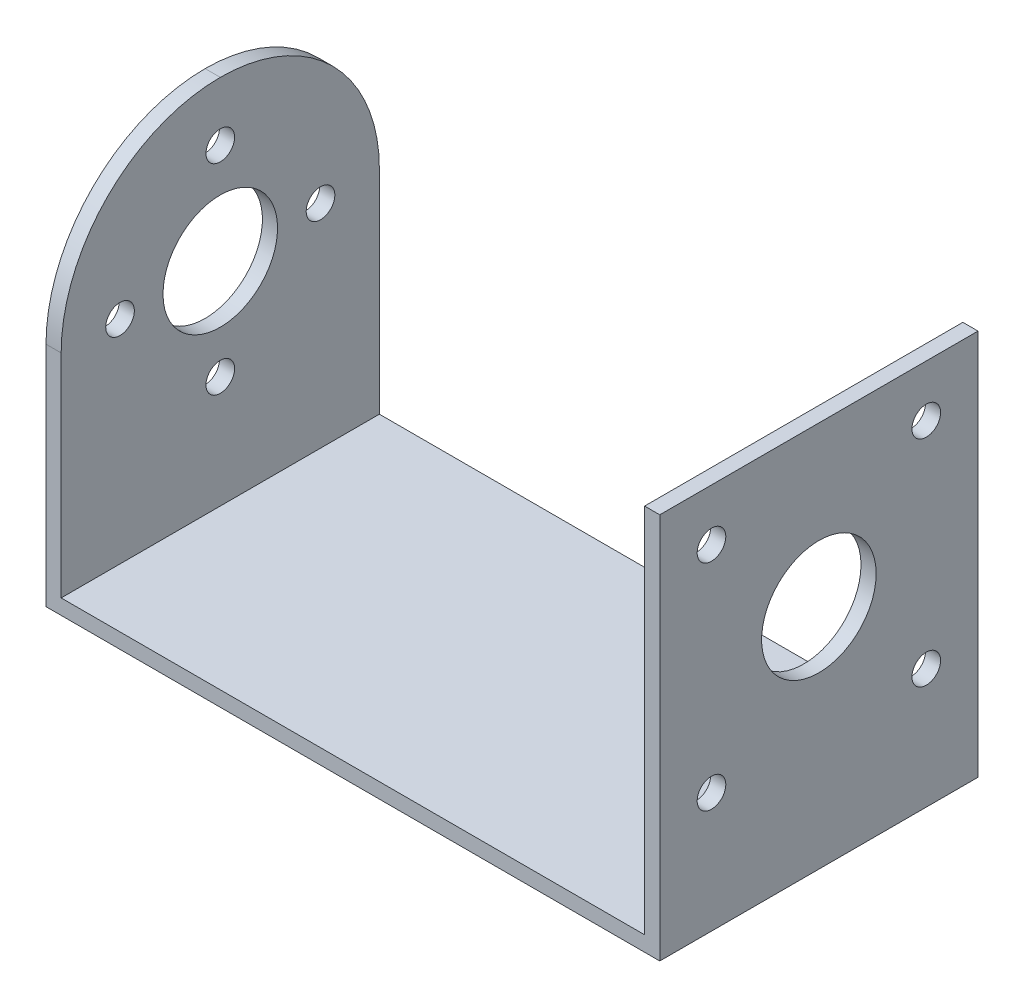
from build123d import *

# Parameters (mm, degrees)
BOSS_EXTRUDE1_DEPTH = 22.225
FILLET1_R           = 11.1125
SKETCH3_R           = 4
SKETCH3_R_2         = 1
CUT_EXTRUDE2_DEPTH  = 1.058333333
CIRPATTERN1_COUNT   = 4
CUT_EXTRUDE3_START  = -1.058333333
SKETCH2_R           = 1
SKETCH2_R_2         = 4
CUT_EXTRUDE3_DEPTH  = 1.058333333


with BuildPart() as part:
    # Sketch1 → Boss-Extrude1 (new body)
    with BuildSketch(Plane.XY):
        Polygon((0, 26.9875), (0, 0), (42.8625, 0), (42.8625, 26.9875), (41.804166667, 26.9875), (41.804166667, 1.058333333), (1.058333333, 1.058333333), (1.058333333, 26.9875), align=None)
    extrude(amount=BOSS_EXTRUDE1_DEPTH)

    # Fillet1
    fillet1_edges = [part.edges().sort_by_distance(p)[0] for p in [
        (0.529166667, 26.9875, 0),
        (0.529166667, 26.9875, 22.225),
    ]]
    fillet(fillet1_edges, radius=FILLET1_R - 0.0001)  # a hair under: the kernel refuses the full size

    # Sketch3 → Cut-Extrude2 (cut)
    with BuildSketch(Plane.ZY):
        with Locations((11.1125, 15.875)):
            Circle(SKETCH3_R)
        with Locations((11.1125, 22.875)):
            Circle(SKETCH3_R_2)
    cut_extrude2 = extrude(amount=-CUT_EXTRUDE2_DEPTH, mode=Mode.SUBTRACT)

    # CirPattern1: Cut-Extrude2 ×4 about axis
    cirpattern1_axis = Axis((0, 15.875, 11.1125), (1, 0, 0))
    for i in range(1, CIRPATTERN1_COUNT):
        add(cut_extrude2.rotate(cirpattern1_axis, i * 360 / CIRPATTERN1_COUNT), mode=Mode.SUBTRACT)

    # Sketch2 → Cut-Extrude3 (cut)
    with BuildSketch(Plane(origin=(42.8625, 0, 0), x_dir=(0, 0, -1), z_dir=(1, 0, 0)).offset(CUT_EXTRUDE3_START)):
        with Locations((-3.6125, 23.375)):
            Circle(SKETCH2_R)
        with Locations((-18.6125, 23.375)):
            Circle(SKETCH2_R)
        with Locations((-3.6125, 8.375)):
            Circle(SKETCH2_R)
        with Locations((-18.6125, 8.375)):
            Circle(SKETCH2_R)
        with Locations(Location((-11.1125, 15.875, 0), (0, 0, 180))):
            Circle(SKETCH2_R_2)
    extrude(amount=CUT_EXTRUDE3_DEPTH, mode=Mode.SUBTRACT)


solid = part.part
